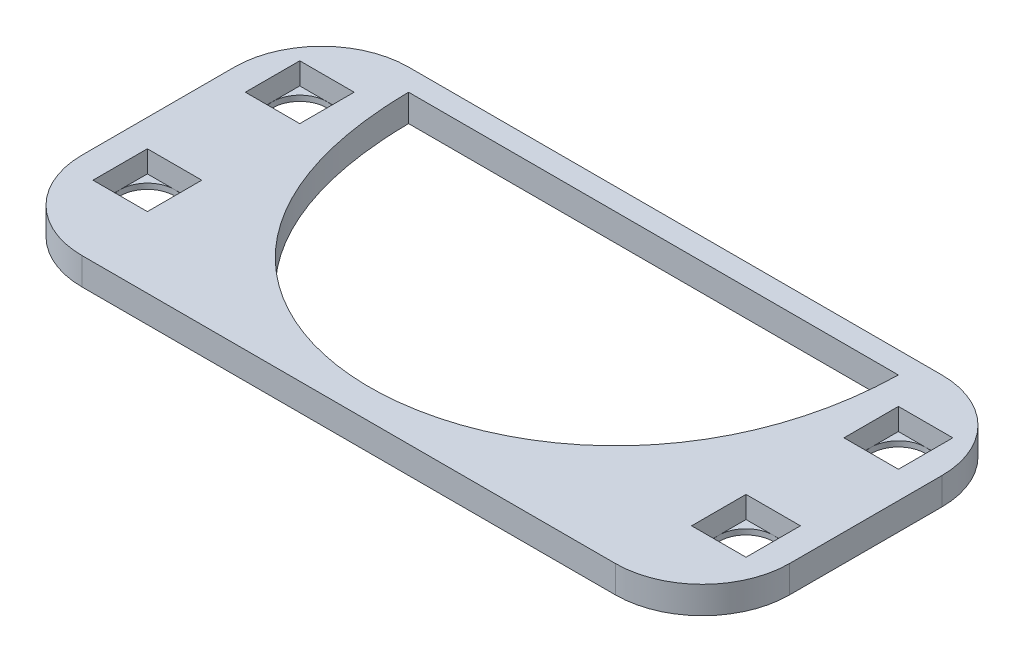
from build123d import *

# Parameters (mm, degrees)
SKETCH1_W           = 65
SKETCH1_H           = 30
BOSS_EXTRUDE1_DEPTH = 2.5
SKETCH2_R           = 2.5
CUT_EXTRUDE1_DEPTH  = 72.632743909
CUT_EXTRUDE2_DEPTH  = 2
FILLET1_R           = 8


with BuildPart() as part:
    # Sketch1 → Boss-Extrude1 (new body)
    with BuildSketch(Plane(origin=(0, 0, 0), x_dir=(1, 0, 0), z_dir=(0, 1, 0))):
        with Locations((32.5, 15)):
            Rectangle(SKETCH1_W, SKETCH1_H)
    extrude(amount=BOSS_EXTRUDE1_DEPTH)

    # Sketch2 → Cut-Extrude1 (cut, through all)
    with BuildSketch(Plane(origin=(0, 2.5, 0), x_dir=(1, 0, 0), z_dir=(0, 1, 0))):
        with Locations((5, 23)):
            Circle(SKETCH2_R)
        with Locations((5, 9)):
            Circle(SKETCH2_R)
        with Locations((60, 23)):
            Circle(SKETCH2_R)
        with Locations((60, 9)):
            Circle(SKETCH2_R)
        with BuildLine():
            Line((10, 28), (55, 28))
            add(Edge.make_bspline(
                [(55, 28), (54.263620849, -4.332136717), (10.33607355, -7.019589548), (10, 28)],
                knots=[0, 0, 0, 0, 1, 1, 1, 1], degree=3))
        make_face()
    extrude(amount=-CUT_EXTRUDE1_DEPTH, mode=Mode.SUBTRACT)

    # Sketch2<3> → Cut-Extrude2 (cut)
    with BuildSketch(Plane(origin=(0, 2.5, 0), x_dir=(1, 0, 0), z_dir=(0, 1, 0))):
        with BuildLine():
            Line((7.5, 23), (7.5, 25.5))
            Line((7.5, 25.5), (5, 25.5))
            ThreePointArc((5, 25.5), (6.767766953, 24.767766953), (7.5, 23))
        make_face()
        with BuildLine():
            ThreePointArc((2.5, 23), (3.232233047, 24.767766953), (5, 25.5))
            Line((5, 25.5), (2.5, 25.5))
            Line((2.5, 25.5), (2.5, 23))
        make_face()
        with BuildLine():
            Line((7.5, 20.5), (7.5, 23))
            ThreePointArc((7.5, 23), (6.767766953, 21.232233047), (5, 20.5))
            Line((5, 20.5), (7.5, 20.5))
        make_face()
        with BuildLine():
            ThreePointArc((5, 20.5), (3.232233047, 21.232233047), (2.5, 23))
            Line((2.5, 23), (2.5, 20.5))
            Line((2.5, 20.5), (5, 20.5))
        make_face()
        with BuildLine():
            Line((7.5, 9), (7.5, 11.5))
            Line((7.5, 11.5), (5, 11.5))
            ThreePointArc((5, 11.5), (6.767766953, 10.767766953), (7.5, 9))
        make_face()
        with BuildLine():
            ThreePointArc((2.5, 9), (3.232233047, 10.767766953), (5, 11.5))
            Line((5, 11.5), (2.5, 11.5))
            Line((2.5, 11.5), (2.5, 9))
        make_face()
        with BuildLine():
            Line((7.5, 6.5), (7.5, 9))
            ThreePointArc((7.5, 9), (6.767766945, 7.232233039), (4.999999978, 6.5))
            Line((4.999999978, 6.5), (7.5, 6.5))
        make_face()
        with BuildLine():
            ThreePointArc((4.999999978, 6.5), (3.232233039, 7.232233055), (2.5, 9))
            Line((2.5, 9), (2.5, 6.5))
            Line((2.5, 6.5), (4.999999978, 6.5))
        make_face()
        with BuildLine():
            Line((60, 11.5), (57.5, 11.5))
            Line((57.5, 11.5), (57.5, 9))
            ThreePointArc((57.5, 9), (58.232233047, 10.767766953), (60, 11.5))
        make_face()
        with BuildLine():
            Line((62.5, 11.5), (60, 11.5))
            ThreePointArc((60, 11.5), (61.767766953, 10.767766953), (62.5, 9))
            Line((62.5, 9), (62.5, 11.5))
        make_face()
        with BuildLine():
            ThreePointArc((60, 6.5), (58.232233047, 7.232233047), (57.5, 9))
            Line((57.5, 9), (57.5, 6.5))
            Line((57.5, 6.5), (60, 6.5))
        make_face()
        with BuildLine():
            Line((62.5, 6.5), (62.5, 9))
            ThreePointArc((62.5, 9), (61.767766953, 7.232233047), (60, 6.5))
            Line((60, 6.5), (62.5, 6.5))
        make_face()
        with BuildLine():
            Line((60, 25.5), (57.5, 25.5))
            Line((57.5, 25.5), (57.5, 23))
            ThreePointArc((57.5, 23), (58.232233047, 24.767766953), (60, 25.5))
        make_face()
        with BuildLine():
            Line((62.5, 25.5), (60, 25.5))
            ThreePointArc((60, 25.5), (61.767766953, 24.767766953), (62.5, 23))
            Line((62.5, 23), (62.5, 25.5))
        make_face()
        with BuildLine():
            ThreePointArc((60, 20.5), (58.232233047, 21.232233047), (57.5, 23))
            Line((57.5, 23), (57.5, 20.5))
            Line((57.5, 20.5), (60, 20.5))
        make_face()
        with BuildLine():
            Line((62.5, 20.5), (62.5, 23))
            ThreePointArc((62.5, 23), (61.767766953, 21.232233047), (60, 20.5))
            Line((60, 20.5), (62.5, 20.5))
        make_face()
    extrude(amount=-CUT_EXTRUDE2_DEPTH, mode=Mode.SUBTRACT)

    # Fillet1
    fillet1_edges = [part.edges().sort_by_distance(p)[0] for p in [
        (65, 1.25, 0),
        (65, 1.25, -30),
        (0, 1.25, -30),
        (0, 1.25, 0),
    ]]
    fillet(fillet1_edges, radius=FILLET1_R)


solid = part.part
